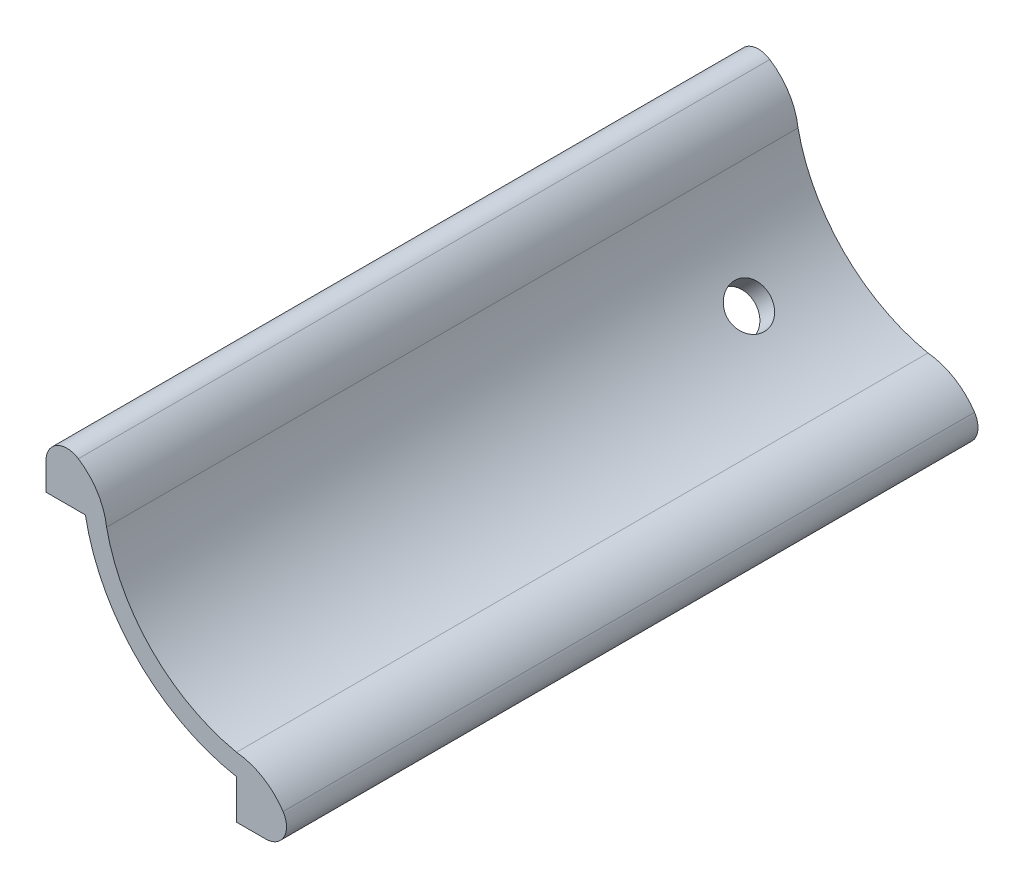
from build123d import *

# Parameters (mm, degrees)
BOSS_EXTRUDE1_DEPTH = 104.775
BOSS_EXTRUDE2_DEPTH = 92.5957
BOSS_EXTRUDE3_START = -5.8293
BOSS_EXTRUDE3_DEPTH = 5.8293
BOSS_EXTRUDE4_DEPTH = 6.35
SKETCH5_W           = 7.787485422
SKETCH5_H           = 19.833751934
SKETCH5_W_2         = 22.754058967
SKETCH5_H_2         = 3.407024872
CUT_EXTRUDE1_DEPTH  = 227.312030137
FILLET1_R           = 6.35
SKETCH6_R           = 6.35
CUT_EXTRUDE2_DEPTH  = 6.35


with BuildPart() as part:
    # Sketch1 → Boss-Extrude1 (new, symmetric)
    with BuildSketch(Plane.XY):
        with BuildLine():
            Line((-58.2422, 56.2102), (-58.2422, 62.5602))
            ThreePointArc((-58.2422, 62.5602), (-45.640852469, 57.743322347), (-39.3748699, 45.7962))
            ThreePointArc((-39.3748699, 45.7962), (-25.556268964, 20.239931036), (0, 6.4213301))
            ThreePointArc((0, 6.4213301), (12.247457496, 0.293755183), (17.272, -12.446))
            Line((17.272, -12.446), (10.922, -12.446))
            ThreePointArc((10.922, -12.446), (7.760938146, -4.204686933), (0, 0))
            ThreePointArc((0, 0), (-30.011530905, 15.784669095), (-45.7962, 45.7962))
            ThreePointArc((-45.7962, 45.7962), (-50.144819563, 53.243313205), (-58.2422, 56.2102))
        make_face()
    extrude(amount=BOSS_EXTRUDE1_DEPTH, both=True)


with BuildPart() as boss_extrude2_tool:
    # Sketch2 → Boss-Extrude2 (new, symmetric)
    with BuildSketch(Plane.XY):
        with BuildLine():
            Line((-58.2422, 56.2102), (-58.2422, 45.796198296))
            Line((-58.2422, 45.796198296), (-45.796199685, 45.796198296))
            ThreePointArc((-45.796199685, 45.796198296), (-50.144818899, 53.243312648), (-58.2422, 56.2102))
        make_face()
        with BuildLine():
            Line((0, 0), (0, -12.446))
            Line((0, -12.446), (10.922, -12.446))
            ThreePointArc((10.922, -12.446), (7.760938146, -4.204686933), (0, 0))
        make_face()
    extrude(amount=BOSS_EXTRUDE2_DEPTH, both=True)


with BuildPart() as part_1:
    add(part.part)


with BuildPart() as part_2:
    # Boss-Extrude2: joined with boss_extrude2_tool
    add(part_1.part.fuse(boss_extrude2_tool.part, tol=0.00001))

    # Sketch3 → Boss-Extrude3 (add)
    with BuildSketch(Plane(origin=(0, 0, -104.775), x_dir=(-1, 0, 0), z_dir=(0, 0, -1)).offset(BOSS_EXTRUDE3_START)):
        with BuildLine():
            Line((58.2422, 56.2102), (58.2422, 45.796198296))
            Line((58.2422, 45.796198296), (45.7962, 45.7962))
            ThreePointArc((45.7962, 45.7962), (50.144819563, 53.243313205), (58.2422, 56.2102))
        make_face()
        with BuildLine():
            Line((0, 0), (0, -12.446))
            Line((0, -12.446), (-10.922, -12.446))
            ThreePointArc((-10.922, -12.446), (-7.760938146, -4.204686933), (0, 0))
        make_face()
    extrude(amount=BOSS_EXTRUDE3_DEPTH)

    # Sketch4 → Boss-Extrude4 (add)
    with BuildSketch(Plane.XY.offset(104.775)):
        with BuildLine():
            Line((-58.2422, 56.2102), (-58.2422, 45.796198296))
            Line((-58.2422, 45.796198296), (-45.7962, 45.7962))
            ThreePointArc((-45.7962, 45.7962), (-50.144819563, 53.243313205), (-58.2422, 56.2102))
        make_face()
        with BuildLine():
            Line((0, 0), (0, -12.446))
            Line((0, -12.446), (10.922, -12.446))
            ThreePointArc((10.922, -12.446), (7.760938146, -4.204686933), (0, 0))
        make_face()
    extrude(amount=-BOSS_EXTRUDE4_DEPTH)

    # Sketch5 → Cut-Extrude1 (cut, through all)
    with BuildSketch(Plane.XY.offset(104.775)):
        with Locations((-61.627942711, 54.680509116)):
            Rectangle(SKETCH5_W, SKETCH5_H)
        with Locations((8.225058429, -13.641512436)):
            Rectangle(SKETCH5_W_2, SKETCH5_H_2)
    extrude(amount=-CUT_EXTRUDE1_DEPTH, mode=Mode.SUBTRACT)

    # Fillet1
    # the kernel refuses this fillet: 6.35 mm, written as the material it takes off along each edge
    with BuildSketch(Plane(origin=(17.260151367, -11.938, -130.624178653), x_dir=(-0.30497213299383213, 0.9523612749882223, 0), z_dir=(0, 0, 1))) as fillet1_piece_1:
        with BuildLine():
            CenterArc((8.625598356, 6.114282737), FILLET1_R, 162.243512631, 123.416753829)
            Line((2.57810426, 8.050855782), (0, 0))
            ThreePointArc((0, 0), (5.169835731, -0.710949564), (10.339671461, 0))
        make_face()
    extrude(amount=261.248357306, mode=Mode.SUBTRACT)
    with BuildSketch(Plane(origin=(-57.7342, 62.551510856, -130.462315531), x_dir=(0.9544368882494849, -0.29841284548196007, 0), z_dir=(0, 0, 1))) as fillet1_piece_2:
        with BuildLine():
            CenterArc((8.565200947, -6.11549994), FILLET1_R, 74.380472255, 122.981827606)
            Line((2.504526706, -8.010421509), (0, 0))
            ThreePointArc((0, 0), (5.137463106, 0.704636839), (10.274926212, 0))
        make_face()
    extrude(amount=260.924631062, mode=Mode.SUBTRACT)

    # Sketch6 → Cut-Extrude2 (cut, symmetric)
    with BuildSketch(Plane(origin=(-5.969, -5.969000176, 0), x_dir=(-0.7071067916239179, 0.7071067707491772, 0), z_dir=(-0.7071067707491772, -0.7071067916239179, 0))):
        with Locations(Location((32.382802858, 75.980128158, 0), (0, 0, 180))):
            Circle(SKETCH6_R)
    extrude(amount=CUT_EXTRUDE2_DEPTH, both=True, mode=Mode.SUBTRACT)


solid = part_2.part
